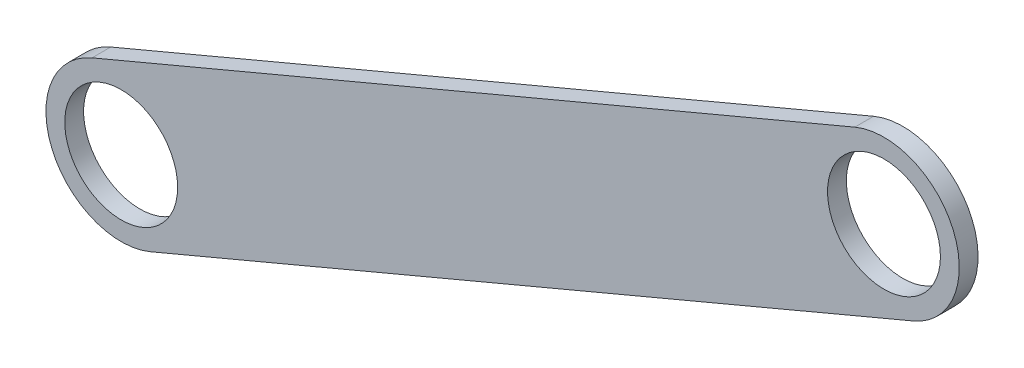
from build123d import *

# Parameters (mm, degrees)
ESQUISSE1_R               = 3
T_LE_DE_BASE_PLI_E1_DEPTH = 1


# Sheet-metal steps are written as plain solids
with BuildPart() as part:
    # Esquisse1 → Tôle de base pliée1 (new body)
    with BuildSketch(Plane.XY):
        with BuildLine():
            Line((34.956432932, 18.395713176), (-5.591174881, 1.310880702))
            ThreePointArc((-5.591174881, 1.310880702), (-10.830487634, 3.443860278), (-8.697508058, 8.683173031))
            Line((-8.697508058, 8.683173031), (31.850099755, 25.768005506))
            ThreePointArc((31.850099755, 25.768005506), (37.089412508, 23.63502593), (34.956432932, 18.395713176))
        make_face()
        with Locations((33.403266343, 22.081859341)):
            Circle(ESQUISSE1_R, mode=Mode.SUBTRACT)
        with Locations((-7.144341469, 4.997026867)):
            Circle(ESQUISSE1_R, mode=Mode.SUBTRACT)
    extrude(amount=T_LE_DE_BASE_PLI_E1_DEPTH)


solid = part.part
